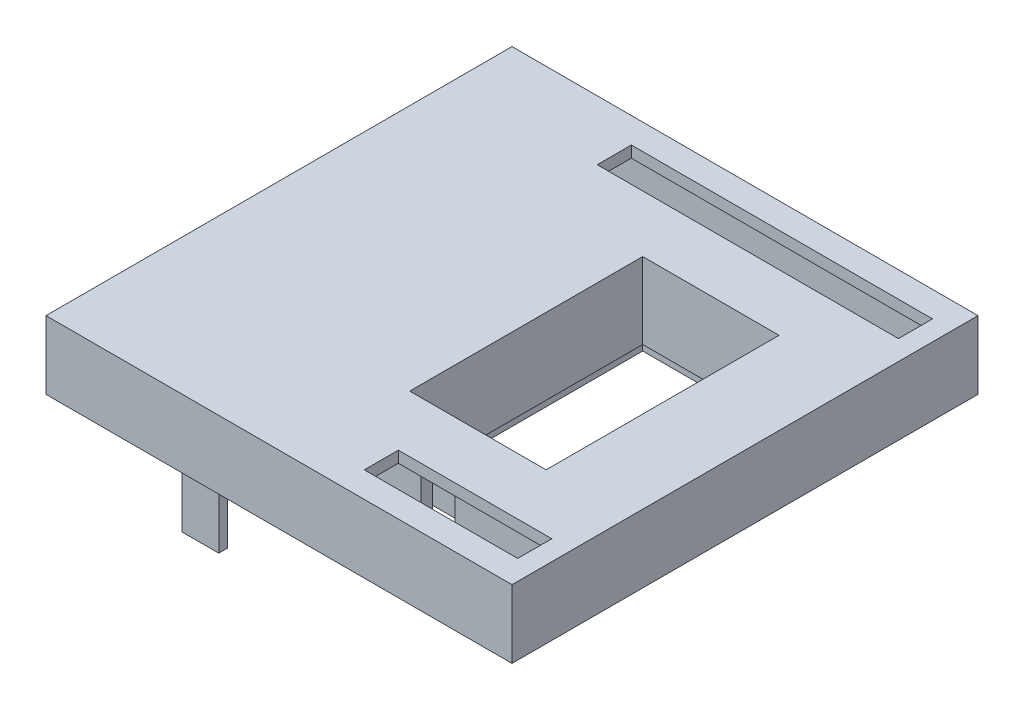
from build123d import *

# Parameters (mm, degrees)
SKETCH5_W                 = 82
SKETCH5_H                 = 82
BOSS_EXTRUDE3_DEPTH       = 2
SKETCH9_W                 = 82
SKETCH9_H                 = 82
SKETCH9_W_2               = 75
SKETCH9_H_2               = 75
BOSS_EXTRUDE5_DEPTH       = 5
BOSS_EXTRUDE4_DEPTH       = 17.4
SKETCH7_W                 = 24
SKETCH7_H                 = 41
SKETCH7_W_2               = 27
SKETCH7_H_2               = 6
SKETCH7_W_3               = 53
CUT_EXTRUDE1_DEPTH        = 2
SKETCH10_W                = 6.5
SKETCH10_H                = 1.5
BOSS_EXTRUDE6_DEPTH       = 15
BOSS_EXTRUDE7_OUTLINE_W   = 82
BOSS_EXTRUDE7_OUTLINE_H   = 82
BOSS_EXTRUDE7_OUTLINE_W_2 = 80
BOSS_EXTRUDE7_OUTLINE_H_2 = 80
BOSS_EXTRUDE7_OUTLINE_W_3 = 77
BOSS_EXTRUDE7_OUTLINE_H_3 = 77
BOSS_EXTRUDE7_OUTLINE_W_4 = 75
BOSS_EXTRUDE7_OUTLINE_H_4 = 75
BOSS_EXTRUDE7_DEPTH       = 5
SKETCH12_W                = 28
SKETCH12_H                = 45
SKETCH12_W_2              = 24
SKETCH12_H_2              = 41
BOSS_EXTRUDE8_DEPTH       = 11.4


# Read off the part's stored shape, not the designer's step: Boss-Extrude7
with BuildPart() as part:
    # Sketch5 → Boss-Extrude3 (new body)
    with BuildSketch(Plane(origin=(0, 0, 0), x_dir=(1, 0, 0), z_dir=(0, 1, 0))):
        with Locations((40, 40)):
            Rectangle(SKETCH5_W, SKETCH5_H)
    extrude(amount=BOSS_EXTRUDE3_DEPTH)

    # Sketch9 → Boss-Extrude5 (add)
    with BuildSketch(Plane.XZ):
        with Locations((40, -40)):
            Rectangle(SKETCH9_W, SKETCH9_H)
        with Locations((40, -40)):
            Rectangle(SKETCH9_W_2, SKETCH9_H_2, mode=Mode.SUBTRACT)
    extrude(amount=BOSS_EXTRUDE5_DEPTH)

    # Sketch6 → Boss-Extrude4 (add)
    with BuildSketch(Plane.XZ):
        Polygon((35.5, -12.5), (35.5, -67.5), (73.5, -67.5), (73.5, -12.5), (57.5, -12.5), (57.5, -14.5), (71.5, -14.5), (71.5, -65.5), (37.5, -65.5), (37.5, -14.5), (51.5, -14.5), (51.5, -12.5), align=None)
    extrude(amount=BOSS_EXTRUDE4_DEPTH)

    # Sketch7 → Cut-Extrude1 (cut)
    with BuildSketch(Plane.XZ):
        with Locations((54.5, -40)):
            Rectangle(SKETCH7_W, SKETCH7_H)
        with Locations((64, -6.5)):
            Rectangle(SKETCH7_W_2, SKETCH7_H_2)
        with Locations((51, -73.5)):
            Rectangle(SKETCH7_W_3, SKETCH7_H_2)
    extrude(amount=-CUT_EXTRUDE1_DEPTH, mode=Mode.SUBTRACT)

    # Sketch10 → Boss-Extrude6 (add)
    with BuildSketch(Plane.XZ.offset(5)):
        with Locations((25.15, -0.75)):
            Rectangle(SKETCH10_W, SKETCH10_H)
    extrude(amount=BOSS_EXTRUDE6_DEPTH)

    # Boss-Extrude7 outline → Boss-Extrude7 (add)
    # profile 1 of 2: a face of its own
    with BuildSketch(Plane(origin=(0, -5, 0), x_dir=(-1, 0, 0), z_dir=(0, -1, 0))):
        with Locations((-40, 40)):
            Rectangle(BOSS_EXTRUDE7_OUTLINE_W, BOSS_EXTRUDE7_OUTLINE_H)
        with Locations((-40, 40)):
            Rectangle(BOSS_EXTRUDE7_OUTLINE_W_2, BOSS_EXTRUDE7_OUTLINE_H_2, mode=Mode.SUBTRACT)
    # profile 2 of 2: a face of its own
    with BuildSketch(Plane(origin=(0, -5, 0), x_dir=(-1, 0, 0), z_dir=(0, -1, 0))):
        with Locations((-40, 40)):
            Rectangle(BOSS_EXTRUDE7_OUTLINE_W_3, BOSS_EXTRUDE7_OUTLINE_H_3)
        with Locations((-40, 40)):
            Rectangle(BOSS_EXTRUDE7_OUTLINE_W_4, BOSS_EXTRUDE7_OUTLINE_H_4, mode=Mode.SUBTRACT)
    extrude(amount=BOSS_EXTRUDE7_DEPTH)

    # Sketch12 → Boss-Extrude8 (add)
    with BuildSketch(Plane.XZ):
        with Locations((54.5, -40)):
            Rectangle(SKETCH12_W, SKETCH12_H)
        with Locations((54.5, -40)):
            Rectangle(SKETCH12_W_2, SKETCH12_H_2, mode=Mode.SUBTRACT)
    extrude(amount=BOSS_EXTRUDE8_DEPTH)


solid = part.part
